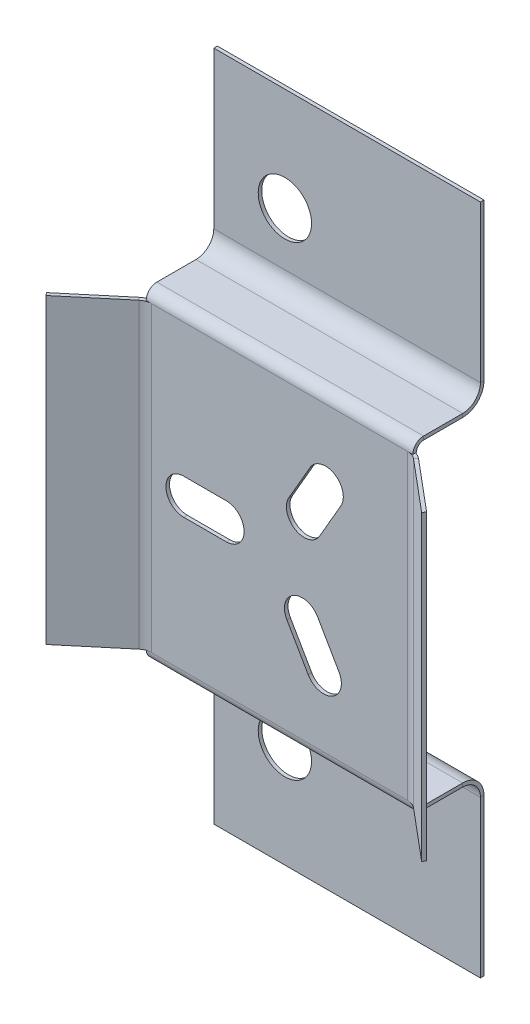
from build123d import *

# Parameters (mm, degrees)
BASE_FLANGE1_START           = -0.5
BASE_FLANGE1_OUTLINE_W       = 91
BASE_FLANGE1_OUTLINE_H       = 75
BASE_FLANGE1_DEPTH           = 1
EDGE_FLANGE1_STRIP_W         = 8
EDGE_FLANGE1_STRIP_H         = 1
EDGE_FLANGE1_STRIP_CUT_DEPTH = 75
EDGE_FLANGE1_DEPTH           = 75
EDGE_FLANGE2_STRIP_W         = 14
EDGE_FLANGE2_STRIP_H         = 1
EDGE_FLANGE2_STRIP_CUT_DEPTH = 75
EDGE_FLANGE2_DEPTH           = 75
EDGE_FLANGE3_START           = -42.5
EDGE_FLANGE3_DEPTH           = 85
EDGE_FLANGE3_2_DEPTH         = 85
CUT_EXTRUDE1_DEPTH           = 111.402059319
CUT_EXTRUDE1_DEPTH_BACK      = 111.402059319
CUT_EXTRUDE2_DEPTH           = 114.152126139
CUT_EXTRUDE2_DEPTH_BACK      = 114.152126139
SKETCH16_R                   = 7.5


# Read off the part's stored shape, not the designer's step: Base-Flange1, Edge-Flange3
# Sheet-metal steps are written as plain solids
with BuildPart() as part:
    # Base-Flange1 outline → Base-Flange1 (new body)
    with BuildSketch(Plane(origin=(0, 0, 0), x_dir=(0, 1, 0), z_dir=(0, 0, 1)).offset(BASE_FLANGE1_START)):
        Rectangle(BASE_FLANGE1_OUTLINE_W, BASE_FLANGE1_OUTLINE_H)
    extrude(amount=BASE_FLANGE1_DEPTH)

    # Edge-Flange1 strip (across the edge) → Edge-Flange1 strip cut (cut)
    with BuildSketch(Plane(origin=(37.5, -45.5, -0.5), x_dir=(0, 1, 0), z_dir=(-1, 0, 0))):
        with Locations((-1, -0.5)):
            Rectangle(EDGE_FLANGE1_STRIP_W, EDGE_FLANGE1_STRIP_H)
    edge_flange1_strip_cut = extrude(amount=EDGE_FLANGE1_STRIP_CUT_DEPTH, mode=Mode.SUBTRACT)

    # Edge-Flange1 section (across the edge) → Edge-Flange1 (add)
    with BuildSketch(Plane(origin=(37.5, -45.5, -0.5), x_dir=(0, 1, 0), z_dir=(-1, 0, 0))):
        with BuildLine():
            Line((0, 2), (0, 19))
            Line((0, 19), (1, 19))
            Line((1, 19), (1, 2))
            ThreePointArc((1, 2), (1.585786438, 0.585786438), (3, 0))
            Line((3, 0), (3, -1))
            ThreePointArc((3, -1), (0.878679656, -0.121320344), (0, 2))
        make_face()
    edge_flange1 = extrude(amount=EDGE_FLANGE1_DEPTH)

    # Edge-Flange2 strip (across the edge) → Edge-Flange2 strip cut (cut)
    with BuildSketch(Plane(origin=(-37.5, -45.5, -19.5), x_dir=(0, 0, 1), z_dir=(1, 0, 0))):
        with Locations((-1, -0.5)):
            Rectangle(EDGE_FLANGE2_STRIP_W, EDGE_FLANGE2_STRIP_H)
    edge_flange2_strip_cut = extrude(amount=EDGE_FLANGE2_STRIP_CUT_DEPTH, mode=Mode.SUBTRACT)

    # Edge-Flange2 section (across the edge) → Edge-Flange2 (add)
    with BuildSketch(Plane(origin=(-37.5, -45.5, -19.5), x_dir=(0, 0, 1), z_dir=(1, 0, 0))):
        with BuildLine():
            Line((0, 5), (0, 49))
            Line((0, 49), (1, 49))
            Line((1, 49), (1, 5))
            ThreePointArc((1, 5), (2.464466094, 1.464466094), (6, 0))
            Line((6, 0), (6, -1))
            ThreePointArc((6, -1), (1.757359313, 0.757359313), (0, 5))
        make_face()
    edge_flange2 = extrude(amount=EDGE_FLANGE2_DEPTH)

    # Mirror1: Edge-Flange1 strip cut, Edge-Flange1, Edge-Flange2 strip cut, Edge-Flange2 across plane
    add(edge_flange1_strip_cut.mirror(Plane.ZX), mode=Mode.SUBTRACT)
    add(edge_flange1.mirror(Plane.ZX))
    add(edge_flange2_strip_cut.mirror(Plane.ZX), mode=Mode.SUBTRACT)
    add(edge_flange2.mirror(Plane.ZX))

    # Edge-Flange3 outline → Edge-Flange3 (cut)
    with BuildSketch(Plane(origin=(0, 0, 0), x_dir=(1, 0, 0), z_dir=(0, 1, 0)).offset(EDGE_FLANGE3_START)):
        with BuildLine():
            ThreePointArc((36.044119063, 0.5), (36.780075537, 0.44554022), (37.5, 0.283347228))
            Line((37.5, 0.283347228), (37.5, 0.5))
            Line((37.5, 0.5), (36.044119063, 0.5))
        make_face()
    edge_flange3 = extrude(amount=EDGE_FLANGE3_DEPTH, mode=Mode.SUBTRACT)

    # Edge-Flange3 2 outline → Edge-Flange3 2 (add)
    with BuildSketch(Plane(origin=(0, 0, 0), x_dir=(1, 0, 0), z_dir=(0, 1, 0)).offset(EDGE_FLANGE3_START)):
        with BuildLine():
            Line((53.463676472, -12.589707751), (39.258057111, -0.669777784))
            ThreePointArc((39.258057111, -0.669777784), (38.427166306, -0.104424288), (37.5, 0.283347228))
            Line((37.5, 0.283347228), (37.5, -0.5))
            Line((37.5, -0.5), (36.044119063, -0.5))
            ThreePointArc((36.044119063, -0.5), (37.412199636, -0.741229517), (38.615269502, -1.435822228))
            Line((38.615269502, -1.435822228), (52.820888862, -13.355752194))
            Line((52.820888862, -13.355752194), (53.463676472, -12.589707751))
        make_face()
    edge_flange3_2 = extrude(amount=EDGE_FLANGE3_2_DEPTH)

    # Mirror2: Edge-Flange3, Edge-Flange3 2 across plane
    add(edge_flange3.mirror(Plane(origin=(0, 0, 0), x_dir=(0, 0, 1), z_dir=(1, 0, 0))), mode=Mode.SUBTRACT)
    add(edge_flange3_2.mirror(Plane(origin=(0, 0, 0), x_dir=(0, 0, 1), z_dir=(1, 0, 0))))

    # Sketch15 → Cut-Extrude1 (cut, two sides: drawn at the far end of the back side and taken through both)
    with BuildSketch(Plane.XY.offset(0.5).offset(-CUT_EXTRUDE1_DEPTH_BACK)):
        with BuildLine():
            Line((-26.955880937, 5), (-14.955880937, 5))
            ThreePointArc((-14.955880937, 5), (-9.955880937, 0), (-14.955880937, -5))
            Line((-14.955880937, -5), (-26.955880937, -5))
            ThreePointArc((-26.955880937, -5), (-31.955880937, 0), (-26.955880937, 5))
        make_face()
        with BuildLine():
            Line((17.262112136, 19.898855266), (11.262112136, 9.50655042))
            ThreePointArc((11.262112136, 9.50655042), (4.431985117, 7.676423401), (2.601858098, 14.50655042))
            Line((2.601858098, 14.50655042), (8.601858098, 24.898855266))
            ThreePointArc((8.601858098, 24.898855266), (15.431985117, 26.728982285), (17.262112136, 19.898855266))
        make_face()
        with BuildLine():
            Line((8.055902747, -25.844477673), (2.055902747, -15.452172827))
            ThreePointArc((2.055902747, -15.452172827), (3.886029766, -8.622045809), (10.716156785, -10.452172827))
            Line((10.716156785, -10.452172827), (16.716156785, -20.844477673))
            ThreePointArc((16.716156785, -20.844477673), (14.886029766, -27.674604692), (8.055902747, -25.844477673))
        make_face()
    extrude(amount=CUT_EXTRUDE1_DEPTH + CUT_EXTRUDE1_DEPTH_BACK, mode=Mode.SUBTRACT)

    # Sketch16 → Cut-Extrude2 (cut, two sides: drawn at the far end of the back side and taken through both)
    with BuildSketch(Plane.XY.offset(-18.5).offset(-CUT_EXTRUDE2_DEPTH_BACK)):
        with Locations((-17.5, 65.5)):
            Circle(SKETCH16_R)
        with Locations(Location((-17.5, -65.5, 0), (0, 0, 270))):
            Circle(SKETCH16_R)
    extrude(amount=CUT_EXTRUDE2_DEPTH + CUT_EXTRUDE2_DEPTH_BACK, mode=Mode.SUBTRACT)


solid = part.part
